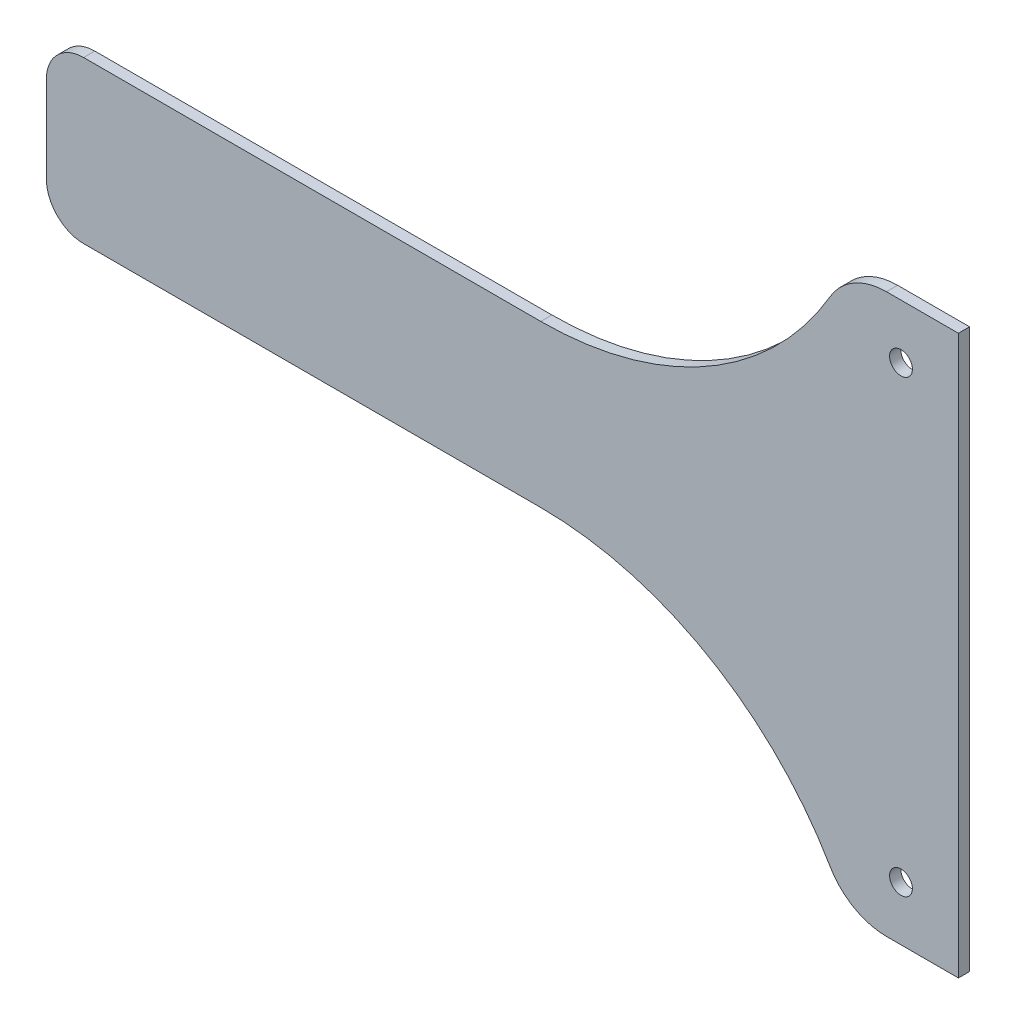
from build123d import *

# Parameters (mm, degrees)
SKETCH1_R           = 1.55575
BOSS_EXTRUDE1_DEPTH = 1.524
FILLET1_R           = 5.08
FILLET2_R           = 45.72
FILLET3_R           = 8.89


with BuildPart() as part:
    # Sketch1 → Boss-Extrude1 (new body)
    with BuildSketch(Plane.XY):
        Polygon((0, 49.0982), (0, 76.2), (15.24, 76.2), (15.24, 0), (0, 0), (0, 27.1018), (-109.22, 27.1018), (-109.22, 49.0982), align=None)
        with Locations(Location((7.4041, 68.7959, 0), (0, 0, 180))):
            Circle(SKETCH1_R, mode=Mode.SUBTRACT)
        with Locations(Location((7.4041, 7.4041, 0), (0, 0, 180))):
            Circle(SKETCH1_R, mode=Mode.SUBTRACT)
    extrude(amount=BOSS_EXTRUDE1_DEPTH)

    # Fillet1
    fillet1_edges = [part.edges().sort_by_distance(p)[0] for p in [
        (-109.22, 27.1018, 0.762),
        (-109.22, 49.0982, 0.762),
    ]]
    fillet(fillet1_edges, radius=FILLET1_R)

    # Fillet2
    # the kernel refuses this fillet: 45.72 mm, written as the material it adds along each edge
    with BuildSketch(Plane(origin=(0, 27.1018, 0), x_dir=(-1, 0, 0), z_dir=(0, 0, 1))) as fillet2_piece_1:
        with BuildLine():
            CenterArc((41.757406873, 45.72), FILLET2_R, 204.030458178, 65.969541822)
            Line((0, 27.1018), (-0.835148137, 26.729436))
            ThreePointArc((-0.835148137, 26.729436), (-0.9144, 13.5509), (-0.9144, 0))
            Line((-0.9144, 0), (0, -0.9144))
            Line((0, -0.9144), (41.757406873, -0.9144))
            Line((41.757406873, -0.9144), (41.757406873, 0))
        make_face()
    extrude(amount=1.524)
    with BuildSketch(Plane(origin=(0, 49.0982, 0), x_dir=(-1, 0, 0), z_dir=(0, 0, 1))) as fillet2_piece_2:
        with BuildLine():
            CenterArc((41.757406873, -45.72), FILLET2_R, 90, 65.969541822)
            Line((0, -27.1018), (-0.835148137, -26.729436))
            ThreePointArc((-0.835148137, -26.729436), (-0.9144, -13.5509), (-0.9144, 0))
            Line((-0.9144, 0), (0, 0.9144))
            Line((0, 0.9144), (41.757406873, 0.9144))
            Line((41.757406873, 0.9144), (41.757406873, 0))
        make_face()
    extrude(amount=1.524)

    # Fillet3
    fillet3_edges = [part.edges().sort_by_distance(p)[0] for p in [
        (0, 76.2, 0.762),
        (0, 0, 0.762),
    ]]
    fillet(fillet3_edges, radius=FILLET3_R)


solid = part.part
